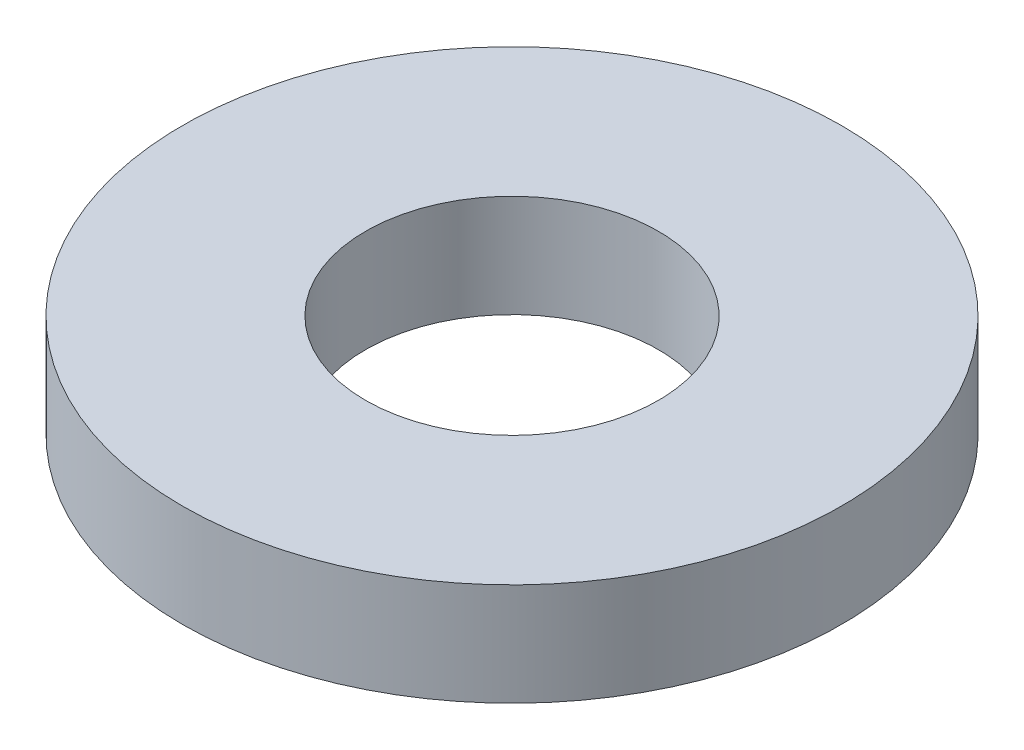
from build123d import *

# Parameters (mm, degrees)
SKETCH1_R           = 90
BOSS_EXTRUDE1_DEPTH = 28
SKETCH2_R           = 40
CUT_EXTRUDE1_DEPTH  = 131.322676461


with BuildPart() as part:
    # Sketch1 → Boss-Extrude1 (new body)
    with BuildSketch(Plane(origin=(0, 0, 0), x_dir=(1, 0, 0), z_dir=(0, 1, 0))):
        Circle(SKETCH1_R)
    extrude(amount=BOSS_EXTRUDE1_DEPTH)

    # Sketch2 → Cut-Extrude1 (cut, through all)
    with BuildSketch(Plane(origin=(0, 0, 0), x_dir=(1, 0, 0), z_dir=(0, 1, 0))):
        Circle(SKETCH2_R)
    extrude(amount=CUT_EXTRUDE1_DEPTH, mode=Mode.SUBTRACT)


solid = part.part
